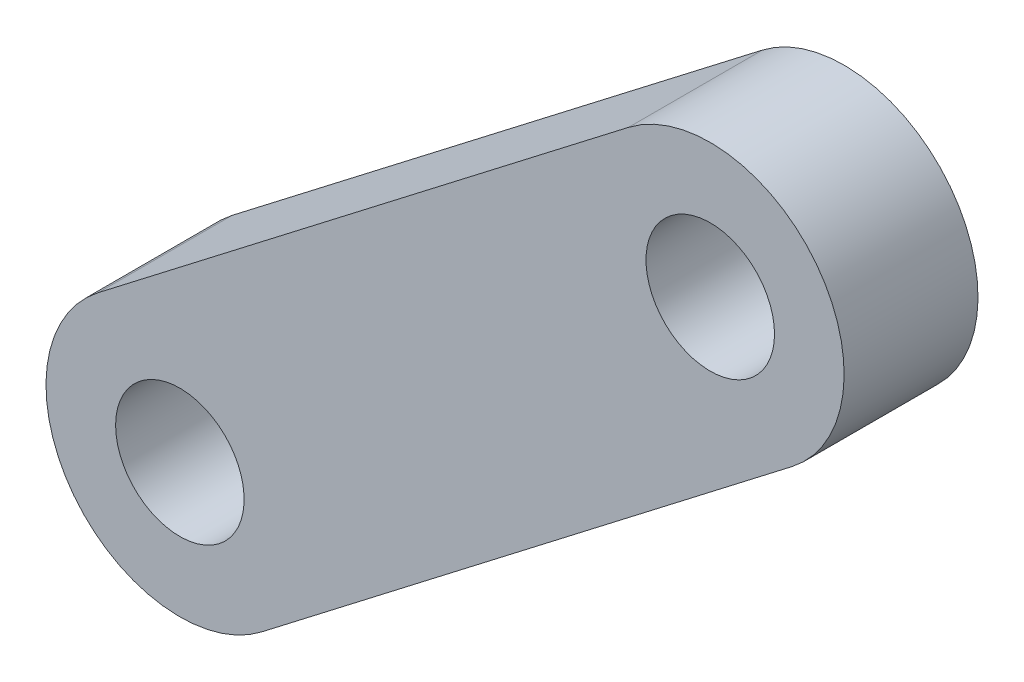
from build123d import *

# Parameters (mm, degrees)
SKETCH1_R           = 2.4
BOSS_EXTRUDE1_DEPTH = 5
SKETCH2_R           = 2.4
CUT_EXTRUDE1_DEPTH  = 5
CUT_EXTRUDE2_DEPTH  = 1


with BuildPart() as part:
    # Sketch1 → Boss-Extrude1 (new body)
    with BuildSketch(Plane(origin=(0, 0, 0), x_dir=(0.9997573026985189, -0.022030335925312537, 0), z_dir=(0, 0, 1))):
        with BuildLine():
            Line((-29.904437649, 103.275259833), (-49.372163993, 87.590629426))
            ThreePointArc((-49.372163993, 87.590629426), (-50.12878318, 80.560158076), (-43.09831183, 79.803538889))
            Line((-43.09831183, 79.803538889), (-23.630585486, 95.488169295))
            ThreePointArc((-23.630585486, 95.488169295), (-23.225758684, 95.852410595), (-22.86294507, 96.25851741))
            ThreePointArc((-22.86294507, 96.25851741), (-23.238207598, 102.923467448), (-29.904437649, 103.275259833))
        make_face()
        with Locations((-26.767511567, 99.381714564)):
            Circle(SKETCH1_R, mode=Mode.SUBTRACT)
    extrude(amount=BOSS_EXTRUDE1_DEPTH)

    # Sketch2 → Cut-Extrude1 (cut)
    with BuildSketch(Plane(origin=(0, 0, 0), x_dir=(-1, 0, 0), z_dir=(0, 0, -1))):
        with Locations((44.380141864, 84.695348924)):
            Circle(SKETCH2_R)
    extrude(amount=-CUT_EXTRUDE1_DEPTH, mode=Mode.SUBTRACT)

    # Sketch4 → Cut-Extrude2 (cut)
    with BuildSketch(Plane(origin=(0, 0, 0), x_dir=(-1, 0, 0), z_dir=(0, 0, -1))):
        Polygon((38.237095204, 87.532175923), (40.067328392, 89.909200633), (41.210775583, 87.135659842), align=None)
    extrude(amount=-CUT_EXTRUDE2_DEPTH, mode=Mode.SUBTRACT)


solid = part.part
